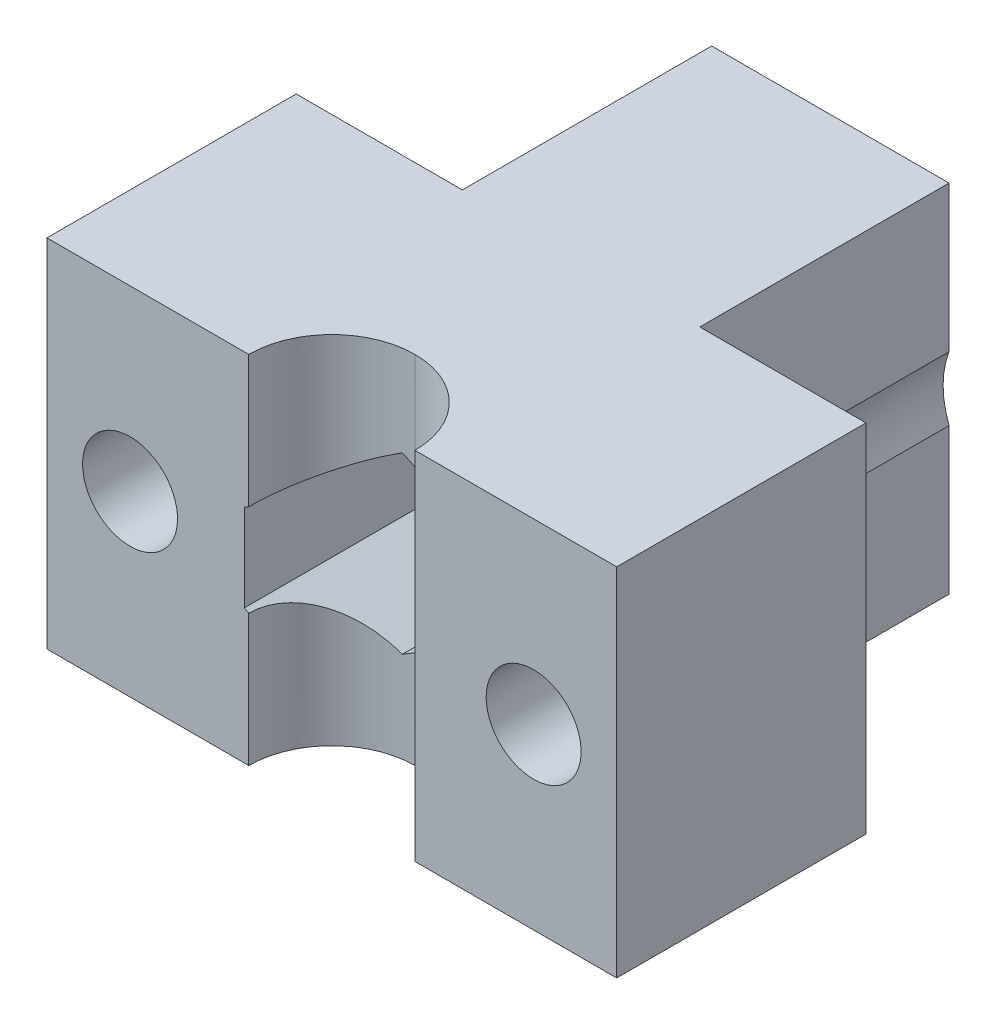
from build123d import *

# Parameters (mm, degrees)
SKETCH_1_W          = 48
SKETCH_1_H          = 20
EXTRUDE_1_DEPTH     = 30
SKETCH_2_W          = 14
SKETCH_2_H          = 30
CUT_EXTRUDE_1_DEPTH = 7
SKETCH_7_W          = 22
SKETCH_7_H          = 30
EXTRUDE_2_DEPTH     = 48
SKETCH_8_W          = 21
SKETCH_8_H          = 30
CUT_EXTRUDE_2_DEPTH = 14
SKETCH_9_W          = 21
SKETCH_9_H          = 30
CUT_EXTRUDE_3_DEPTH = 14
SKETCH_11_W         = 10.2
SKETCH_11_H         = 20.2
CUT_EXTRUDE_4_DEPTH = 56.497747702
SKETCH_13_R         = 4
CUT_EXTRUDE_5_DEPTH = 44.783558558
SKETCH_14_R         = 4
CUT_EXTRUDE_6_DEPTH = 44.783558558
FILLET_1_R          = 7
SKETCH1_W           = 10.2
SKETCH1_H           = 20.2
BOSS_EXTRUDE1_DEPTH = 4
SKETCH_20_R         = 7.5
CUT_EXTRUDE_8_DEPTH = 44.783558558
SKETCH3_R           = 4
CUT_EXTRUDE2_DEPTH  = 57.920997883
CUT_EXTRUDE3_START  = -25
CUT_EXTRUDE3_DEPTH  = 20


with BuildPart() as part:
    # Эскиз1 → Бобышка-Вытянуть1 (new body)
    with BuildSketch(Plane(origin=(0, 0, 0), x_dir=(1, 0, 0), z_dir=(0, 1, 0))):
        Rectangle(SKETCH_1_W, SKETCH_1_H)
    extrude(amount=EXTRUDE_1_DEPTH)

    # Эскиз2 → Вырез-Вытянуть1 (cut)
    with BuildSketch(Plane.XY.offset(10)):
        with Locations((0, 15)):
            Rectangle(SKETCH_2_W, SKETCH_2_H)
    extrude(amount=-CUT_EXTRUDE_1_DEPTH, mode=Mode.SUBTRACT)

    # Эскиз7 → Бобышка-Вытянуть2 (add)
    with BuildSketch(Plane(origin=(24, 0, 0), x_dir=(0, 0, -1), z_dir=(1, 0, 0))):
        with Locations((21, 15)):
            Rectangle(SKETCH_7_W, SKETCH_7_H)
    extrude(amount=-EXTRUDE_2_DEPTH)

    # Эскиз8 → Вырез-Вытянуть2 (cut)
    with BuildSketch(Plane(origin=(24, 0, 0), x_dir=(0, 0, -1), z_dir=(1, 0, 0))):
        with Locations((21.5, 15)):
            Rectangle(SKETCH_8_W, SKETCH_8_H)
    extrude(amount=-CUT_EXTRUDE_2_DEPTH, mode=Mode.SUBTRACT)

    # Эскиз9 → Вырез-Вытянуть3 (cut)
    with BuildSketch(Plane.ZY.offset(24)):
        with Locations((-21.5, 15)):
            Rectangle(SKETCH_9_W, SKETCH_9_H)
    extrude(amount=-CUT_EXTRUDE_3_DEPTH, mode=Mode.SUBTRACT)

    # Эскиз11 → Вырез-Вытянуть4 (cut, through all)
    with BuildSketch(Plane.ZY.offset(10)):
        with Locations((-21.5, 15)):
            Rectangle(SKETCH_11_W, SKETCH_11_H)
    extrude(amount=-CUT_EXTRUDE_4_DEPTH, mode=Mode.SUBTRACT)

    # Эскиз13 → Вырез-Вытянуть5 (cut, through all)
    with BuildSketch(Plane(origin=(0, 0, -11), x_dir=(-1, 0, 0), z_dir=(0, 0, -1))):
        with Locations((17, 15)):
            Circle(SKETCH_13_R)
    extrude(amount=-CUT_EXTRUDE_5_DEPTH, mode=Mode.SUBTRACT)

    # Эскиз14 → Вырез-Вытянуть6 (cut, through all)
    with BuildSketch(Plane(origin=(0, 0, -11), x_dir=(-1, 0, 0), z_dir=(0, 0, -1))):
        with Locations((-17, 15)):
            Circle(SKETCH_14_R)
    extrude(amount=-CUT_EXTRUDE_6_DEPTH, mode=Mode.SUBTRACT)

    # Скругление1
    fillet_1_edges = [part.edges().sort_by_distance(p)[0] for p in [
        (-7, 15, 3),
        (7, 15, 3),
    ]]
    fillet(fillet_1_edges, radius=FILLET_1_R - 0.0001)  # a hair under: the kernel refuses the full size

    # Sketch1 → Boss-Extrude1 (add)
    with BuildSketch(Plane(origin=(10, 0, 0), x_dir=(0, 0, -1), z_dir=(1, 0, 0))):
        with Locations((21.5, 15)):
            Rectangle(SKETCH1_W, SKETCH1_H)
    extrude(amount=-BOSS_EXTRUDE1_DEPTH)

    # Эскиз20 → Вырез-Вытянуть8 (cut, through all)
    with BuildSketch(Plane(origin=(0, 0, -11), x_dir=(-1, 0, 0), z_dir=(0, 0, -1))):
        with Locations((-17, 15)):
            Circle(SKETCH_20_R)
        with Locations((17, 15)):
            Circle(SKETCH_20_R)
    extrude(amount=CUT_EXTRUDE_8_DEPTH, mode=Mode.SUBTRACT)

    # Sketch3 → Cut-Extrude2 (cut, through all)
    with BuildSketch(Plane(origin=(0, 0, -32), x_dir=(-1, 0, 0), z_dir=(0, 0, -1))):
        with Locations(Location((1, 15, 0), (0, 0, 255.522487814))):
            Circle(SKETCH3_R)
    extrude(amount=-CUT_EXTRUDE2_DEPTH, mode=Mode.SUBTRACT)

    # Sketch4 → Cut-Extrude3 (cut)
    with BuildSketch(Plane(origin=(0, 0, -32), x_dir=(-1, 0, 0), z_dir=(0, 0, -1)).offset(CUT_EXTRUDE3_START)):
        Polygon((1, 22.35), (-5.365286718, 18.675), (-5.365286718, 11.325), (1, 7.65), (7.365286718, 11.325), (7.365286718, 18.675), align=None)
    extrude(amount=-CUT_EXTRUDE3_DEPTH, mode=Mode.SUBTRACT)


solid = part.part
